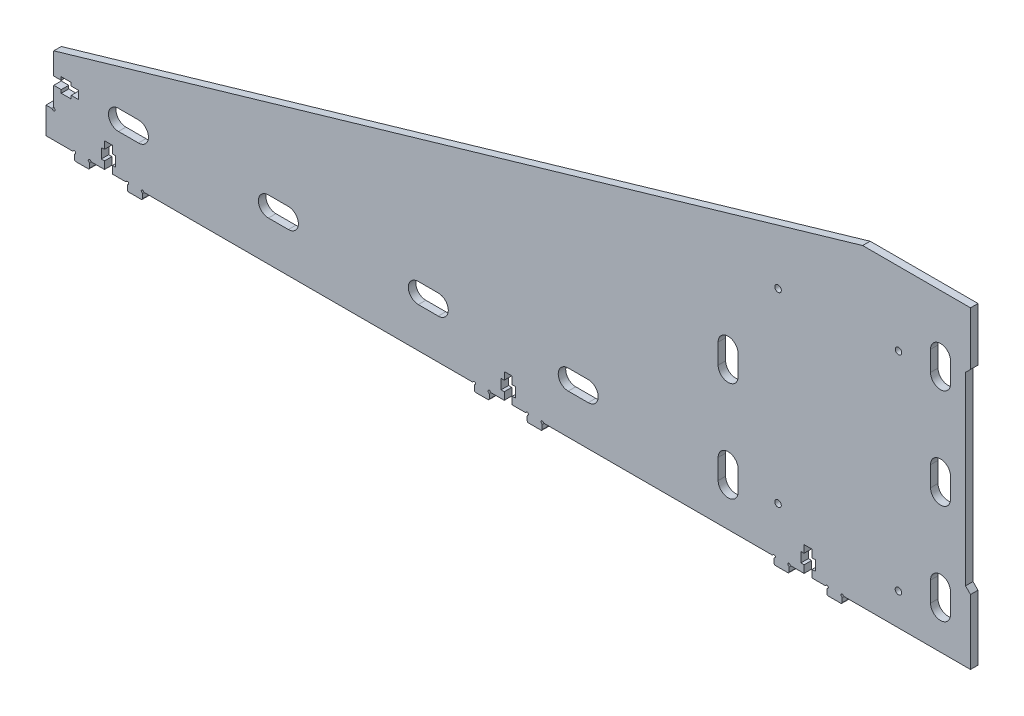
from build123d import *

# Parameters (mm, degrees)
MODEL_R                 = 1.3
SALIENTE_EXTRUIR1_DEPTH = 3


with BuildPart() as part:
    # Model → Saliente-Extruir1 (new body)
    with BuildSketch(Plane.XY):
        with BuildLine():
            Line((448.008092322, 367.996310498), (446.008092322, 365.996306498))
            Line((446.008092322, 365.996306498), (446.008092322, 291.996308498))
            Line((446.008092322, 291.996308498), (448.008092322, 289.996308498))
            Line((448.008092322, 289.996308498), (448.008092322, 263.996308498))
            Line((448.008092322, 263.996308498), (446.008092322, 263.996308498))
            Line((446.008092322, 263.996308498), (437.474128322, 263.996311498))
            Line((437.474128322, 263.996311498), (408.542066187, 263.996308498))
            Line((408.542066187, 263.996308498), (397.474128322, 263.996311498))
            ThreePointArc((397.474128322, 263.996311498), (397.224129455, 264.06329853), (397.04111716, 264.246309995))
            ThreePointArc((397.04111716, 264.246309995), (396.254551683, 264.349860229), (396.358105322, 263.5632952))
            ThreePointArc((396.358105322, 263.5632952), (396.541118024, 263.380282498), (396.608105322, 263.130282498))
            Line((396.608105322, 263.130282498), (396.608108322, 261.496256498))
            ThreePointArc((396.608108322, 261.496256498), (396.461661713, 261.142703108), (396.108108322, 260.996256498))
            Line((396.108108322, 260.996256498), (391.108110322, 260.996256498))
            ThreePointArc((391.108110322, 260.996256498), (390.754556932, 261.142703108), (390.608110322, 261.496256498))
            Line((390.608110322, 261.496256498), (390.608110322, 263.130284498))
            ThreePointArc((390.608110322, 263.130284498), (390.675097104, 263.380283933), (390.858108819, 263.56329666))
            ThreePointArc((390.858108819, 263.56329666), (390.961660812, 264.349862745), (390.175095024, 264.246308498))
            ThreePointArc((390.175095024, 264.246308498), (389.992082322, 264.063295796), (389.742082322, 263.996308498))
            Line((389.742082322, 263.996308498), (384.608088322, 263.996308498))
            Line((384.608088322, 263.996308498), (384.608088322, 266.996280498))
            Line((384.608088322, 266.996280498), (385.883083322, 266.996280498))
            Line((385.883083322, 266.996280498), (385.883083322, 270.996308498))
            Line((385.883083322, 270.996308498), (384.608088322, 270.996308498))
            Line((384.608088322, 270.996308498), (384.608088322, 273.996308498))
            Line((384.608088322, 273.996308498), (381.408077322, 273.996308498))
            Line((381.408077322, 273.996308498), (381.408077322, 270.996308498))
            Line((381.408077322, 270.996308498), (380.133083322, 270.996308498))
            Line((380.133083322, 270.996308498), (380.133083322, 266.996280498))
            Line((380.133083322, 266.996280498), (381.408077322, 266.996280498))
            Line((381.408077322, 266.996280498), (381.408077322, 263.996308498))
            Line((381.408077322, 263.996308498), (376.274112322, 263.996311498))
            ThreePointArc((376.274112322, 263.996311498), (376.024112888, 264.06329828), (375.84110016, 264.246309995))
            ThreePointArc((375.84110016, 264.246309995), (375.054534683, 264.349860229), (375.158088322, 263.5632952))
            ThreePointArc((375.158088322, 263.5632952), (375.341101024, 263.380282498), (375.408088322, 263.130282498))
            Line((375.408088322, 263.130282498), (375.408091322, 261.496256498))
            ThreePointArc((375.408091322, 261.496256498), (375.261644713, 261.142703108), (374.908091322, 260.996256498))
            Line((374.908091322, 260.996256498), (369.908094322, 260.996256498))
            ThreePointArc((369.908094322, 260.996256498), (369.554540932, 261.142703108), (369.408094322, 261.496256498))
            Line((369.408094322, 261.496256498), (369.408094322, 263.130284498))
            ThreePointArc((369.408094322, 263.130284498), (369.475081104, 263.380283933), (369.658092819, 263.56329666))
            ThreePointArc((369.658092819, 263.56329666), (369.761644812, 264.349862745), (368.975079024, 264.246308498))
            ThreePointArc((368.975079024, 264.246308498), (368.792066322, 264.063295796), (368.542066322, 263.996308498))
            Line((368.542066322, 263.996308498), (277.474124322, 263.996311498))
            ThreePointArc((277.474124322, 263.996311498), (277.224125455, 264.06329853), (277.04111316, 264.246309995))
            ThreePointArc((277.04111316, 264.246309995), (276.254547683, 264.349860229), (276.358101322, 263.5632952))
            ThreePointArc((276.358101322, 263.5632952), (276.541114024, 263.380282498), (276.608101322, 263.130282498))
            Line((276.608101322, 263.130282498), (276.608104322, 261.496256498))
            ThreePointArc((276.608104322, 261.496256498), (276.461657713, 261.142703108), (276.108104322, 260.996256498))
            Line((276.108104322, 260.996256498), (271.108106322, 260.996256498))
            ThreePointArc((271.108106322, 260.996256498), (270.754552932, 261.142703108), (270.608106322, 261.496256498))
            Line((270.608106322, 261.496256498), (270.608106322, 263.130284498))
            ThreePointArc((270.608106322, 263.130284498), (270.675093104, 263.380283933), (270.858104819, 263.56329666))
            ThreePointArc((270.858104819, 263.56329666), (270.961656812, 264.349862745), (270.175091024, 264.246308498))
            ThreePointArc((270.175091024, 264.246308498), (269.992078322, 264.063295796), (269.742078322, 263.996308498))
            Line((269.742078322, 263.996308498), (264.608084322, 263.996308498))
            Line((264.608084322, 263.996308498), (264.608084322, 266.996280498))
            Line((264.608084322, 266.996280498), (265.883079322, 266.996280498))
            Line((265.883079322, 266.996280498), (265.883079322, 270.996308498))
            Line((265.883079322, 270.996308498), (264.608084322, 270.996308498))
            Line((264.608084322, 270.996308498), (264.608084322, 273.996308498))
            Line((264.608084322, 273.996308498), (261.408073322, 273.996308498))
            Line((261.408073322, 273.996308498), (261.408073322, 270.996308498))
            Line((261.408073322, 270.996308498), (260.133079322, 270.996308498))
            Line((260.133079322, 270.996308498), (260.133079322, 266.996280498))
            Line((260.133079322, 266.996280498), (261.408073322, 266.996280498))
            Line((261.408073322, 266.996280498), (261.408073322, 263.996308498))
            Line((261.408073322, 263.996308498), (256.274108322, 263.996311498))
            ThreePointArc((256.274108322, 263.996311498), (256.024109455, 264.06329853), (255.84109716, 264.246309995))
            ThreePointArc((255.84109716, 264.246309995), (255.054531683, 264.349860229), (255.158085322, 263.5632952))
            ThreePointArc((255.158085322, 263.5632952), (255.341098024, 263.380282498), (255.408085322, 263.130282498))
            Line((255.408085322, 263.130282498), (255.408088322, 261.496256498))
            ThreePointArc((255.408088322, 261.496256498), (255.261641713, 261.142703108), (254.908088322, 260.996256498))
            Line((254.908088322, 260.996256498), (249.908090322, 260.996256498))
            ThreePointArc((249.908090322, 260.996256498), (249.554536932, 261.142703108), (249.408090322, 261.496256498))
            Line((249.408090322, 261.496256498), (249.408090322, 263.130284498))
            ThreePointArc((249.408090322, 263.130284498), (249.475077104, 263.380283933), (249.658088819, 263.56329666))
            ThreePointArc((249.658088819, 263.56329666), (249.761640812, 264.349862745), (248.975075024, 264.246308498))
            ThreePointArc((248.975075024, 264.246308498), (248.792062322, 264.063295796), (248.542062322, 263.996308498))
            Line((248.542062322, 263.996308498), (117.474128322, 263.996311498))
            ThreePointArc((117.474128322, 263.996311498), (117.224128888, 264.06329828), (117.04111616, 264.246309995))
            ThreePointArc((117.04111616, 264.246309995), (116.254550683, 264.349860229), (116.358104322, 263.5632952))
            ThreePointArc((116.358104322, 263.5632952), (116.541117024, 263.380282498), (116.608104322, 263.130282498))
            Line((116.608104322, 263.130282498), (116.608107322, 261.496256498))
            ThreePointArc((116.608107322, 261.496256498), (116.461660713, 261.142703108), (116.108107322, 260.996256498))
            Line((116.108107322, 260.996256498), (111.108110322, 260.996256498))
            ThreePointArc((111.108110322, 260.996256498), (110.754556932, 261.142703108), (110.608110322, 261.496256498))
            Line((110.608110322, 261.496256498), (110.608110322, 263.130284498))
            ThreePointArc((110.608110322, 263.130284498), (110.675097104, 263.380283933), (110.858108819, 263.56329666))
            ThreePointArc((110.858108819, 263.56329666), (110.961660812, 264.349862745), (110.175095024, 264.246308498))
            ThreePointArc((110.175095024, 264.246308498), (109.992082322, 264.063295796), (109.742082322, 263.996308498))
            Line((109.742082322, 263.996308498), (104.608088322, 263.996308498))
            Line((104.608088322, 263.996308498), (104.608088322, 266.996280498))
            Line((104.608088322, 266.996280498), (105.883082322, 266.996280498))
            Line((105.883082322, 266.996280498), (105.883082322, 270.996308498))
            Line((105.883082322, 270.996308498), (104.608088322, 270.996308498))
            Line((104.608088322, 270.996308498), (104.608088322, 273.996308498))
            Line((104.608088322, 273.996308498), (101.408077322, 273.996308498))
            Line((101.408077322, 273.996308498), (101.408077322, 270.996308498))
            Line((101.408077322, 270.996308498), (100.133082322, 270.996308498))
            Line((100.133082322, 270.996308498), (100.133082322, 266.996280498))
            Line((100.133082322, 266.996280498), (101.408077322, 266.996280498))
            Line((101.408077322, 266.996280498), (101.408077322, 263.996308498))
            Line((101.408077322, 263.996308498), (96.274112322, 263.996311498))
            ThreePointArc((96.274112322, 263.996311498), (96.024112888, 264.06329828), (95.84110016, 264.246309995))
            ThreePointArc((95.84110016, 264.246309995), (95.054534683, 264.349860229), (95.158088322, 263.5632952))
            ThreePointArc((95.158088322, 263.5632952), (95.341101024, 263.380282498), (95.408088322, 263.130282498))
            Line((95.408088322, 263.130282498), (95.408091322, 261.496256498))
            ThreePointArc((95.408091322, 261.496256498), (95.261644713, 261.142703108), (94.908091322, 260.996256498))
            Line((94.908091322, 260.996256498), (89.908094322, 260.996256498))
            ThreePointArc((89.908094322, 260.996256498), (89.554540932, 261.142703108), (89.408094322, 261.496256498))
            Line((89.408094322, 261.496256498), (89.408094322, 263.130284498))
            ThreePointArc((89.408094322, 263.130284498), (89.475081104, 263.380283933), (89.658092819, 263.56329666))
            ThreePointArc((89.658092819, 263.56329666), (89.761643053, 264.349862138), (88.975078024, 264.246308498))
            ThreePointArc((88.975078024, 264.246308498), (88.792065322, 264.063295796), (88.542065322, 263.996308498))
            Line((88.542065322, 263.996308498), (78.008065322, 263.996308498))
            Line((78.008065322, 263.996308498), (78.008065322, 274.646307498))
            Line((78.008065322, 274.646307498), (80.242112322, 274.646307498))
            ThreePointArc((80.242112322, 274.646307498), (80.492112093, 274.579320099), (80.67512462, 274.396307498))
            ThreePointArc((80.67512462, 274.396307498), (81.4616899, 274.292754071), (81.358138826, 275.07931966))
            ThreePointArc((81.358138826, 275.07931966), (81.175127188, 275.262332246), (81.108140322, 275.512331498))
            Line((81.108140322, 275.512331498), (81.108137322, 283.046302498))
            Line((81.108137322, 283.046302498), (84.108109322, 283.046302498))
            Line((84.108109322, 283.046302498), (84.108109322, 281.771307498))
            Line((84.108109322, 281.771307498), (88.108137322, 281.771307498))
            Line((88.108137322, 281.771307498), (88.108137322, 283.046302498))
            Line((88.108137322, 283.046302498), (91.108137322, 283.046302498))
            Line((91.108137322, 283.046302498), (91.108137322, 286.246313498))
            Line((91.108137322, 286.246313498), (88.108137322, 286.246313498))
            Line((88.108137322, 286.246313498), (88.108137322, 287.521307498))
            Line((88.108137322, 287.521307498), (84.108109322, 287.521307498))
            Line((84.108109322, 287.521307498), (84.108109322, 286.246313498))
            Line((84.108109322, 286.246313498), (81.108137322, 286.246313498))
            Line((81.108137322, 286.246313498), (81.108137322, 294.994470498))
            Line((81.108137322, 294.994470498), (403.197581262, 388.89131343))
            Line((403.197581262, 388.89131343), (404.844163308, 389.371331818))
            Line((404.844163308, 389.371331818), (448.008092322, 389.371331818))
            Line((448.008092322, 389.371331818), (448.008092322, 367.996310498))
        make_face()
        with Locations((419.169547464, 276.784810642)):
            Circle(MODEL_R, mode=Mode.SUBTRACT)
        with Locations((419.190433996, 359.984810147)):
            Circle(MODEL_R, mode=Mode.SUBTRACT)
        with Locations((370.975511179, 283.007806353)):
            Circle(MODEL_R, mode=Mode.SUBTRACT)
        with Locations((370.992246648, 357.507806848)):
            Circle(MODEL_R, mode=Mode.SUBTRACT)
        with BuildLine():
            Line((115.008095322, 287.996309498), (107.008095322, 287.996309498))
            ThreePointArc((107.008095322, 287.996309498), (103.008095322, 283.996309498), (107.008095322, 279.996309498))
            Line((107.008095322, 279.996309498), (115.008095322, 279.996309498))
            ThreePointArc((115.008095322, 279.996309498), (119.008095322, 283.996309498), (115.008095322, 287.996309498))
        make_face(mode=Mode.SUBTRACT)
        with BuildLine():
            Line((175.008095322, 287.996309498), (167.008095322, 287.996309498))
            ThreePointArc((167.008095322, 287.996309498), (163.008095322, 283.996309498), (167.008095322, 279.996309498))
            Line((167.008095322, 279.996309498), (175.008095322, 279.996309498))
            ThreePointArc((175.008095322, 279.996309498), (179.008095322, 283.996309498), (175.008095322, 287.996309498))
        make_face(mode=Mode.SUBTRACT)
        with BuildLine():
            Line((235.008095322, 287.996309498), (227.008095322, 287.996309498))
            ThreePointArc((227.008095322, 287.996309498), (223.008095322, 283.996309498), (227.008095322, 279.996309498))
            Line((227.008095322, 279.996309498), (235.008095322, 279.996309498))
            ThreePointArc((235.008095322, 279.996309498), (239.008095322, 283.996309498), (235.008095322, 287.996309498))
        make_face(mode=Mode.SUBTRACT)
        with BuildLine():
            Line((295.008095322, 287.996309498), (287.008095322, 287.996309498))
            ThreePointArc((287.008095322, 287.996309498), (283.008095322, 283.996309498), (287.008095322, 279.996309498))
            Line((287.008095322, 279.996309498), (295.008095322, 279.996309498))
            ThreePointArc((295.008095322, 279.996309498), (299.008095322, 283.996309498), (295.008095322, 287.996309498))
        make_face(mode=Mode.SUBTRACT)
        with BuildLine():
            Line((355.008092322, 278.996307498), (355.008092322, 286.996308498))
            ThreePointArc((355.008092322, 286.996308498), (351.008092322, 290.996308498), (347.008092322, 286.996308498))
            Line((347.008092322, 286.996308498), (347.008092322, 278.996307498))
            ThreePointArc((347.008092322, 278.996307498), (351.008092322, 274.996307498), (355.008092322, 278.996307498))
        make_face(mode=Mode.SUBTRACT)
        with BuildLine():
            Line((355.008092322, 318.996307498), (355.008092322, 326.996308498))
            ThreePointArc((355.008092322, 326.996308498), (351.008092322, 330.996308498), (347.008092322, 326.996308498))
            Line((347.008092322, 326.996308498), (347.008092322, 318.996307498))
            ThreePointArc((347.008092322, 318.996307498), (351.008092322, 314.996307498), (355.008092322, 318.996307498))
        make_face(mode=Mode.SUBTRACT)
        with BuildLine():
            Line((440.008092322, 278.996307498), (440.008092322, 286.996308498))
            ThreePointArc((440.008092322, 286.996308498), (436.008092322, 290.996308498), (432.008092322, 286.996308498))
            Line((432.008092322, 286.996308498), (432.008092322, 278.996307498))
            ThreePointArc((432.008092322, 278.996307498), (436.008092322, 274.996307498), (440.008092322, 278.996307498))
        make_face(mode=Mode.SUBTRACT)
        with BuildLine():
            Line((440.008092322, 318.996307498), (440.008092322, 326.996308498))
            ThreePointArc((440.008092322, 326.996308498), (436.008092322, 330.996308498), (432.008092322, 326.996308498))
            Line((432.008092322, 326.996308498), (432.008092322, 318.996307498))
            ThreePointArc((432.008092322, 318.996307498), (436.008092322, 314.996307498), (440.008092322, 318.996307498))
        make_face(mode=Mode.SUBTRACT)
        with BuildLine():
            Line((440.008092322, 358.996307498), (440.008092322, 366.996308498))
            ThreePointArc((440.008092322, 366.996308498), (436.008092322, 370.996308498), (432.008092322, 366.996308498))
            Line((432.008092322, 366.996308498), (432.008092322, 358.996307498))
            ThreePointArc((432.008092322, 358.996307498), (436.008092322, 354.996307498), (440.008092322, 358.996307498))
        make_face(mode=Mode.SUBTRACT)
    extrude(amount=SALIENTE_EXTRUIR1_DEPTH)


solid = part.part
